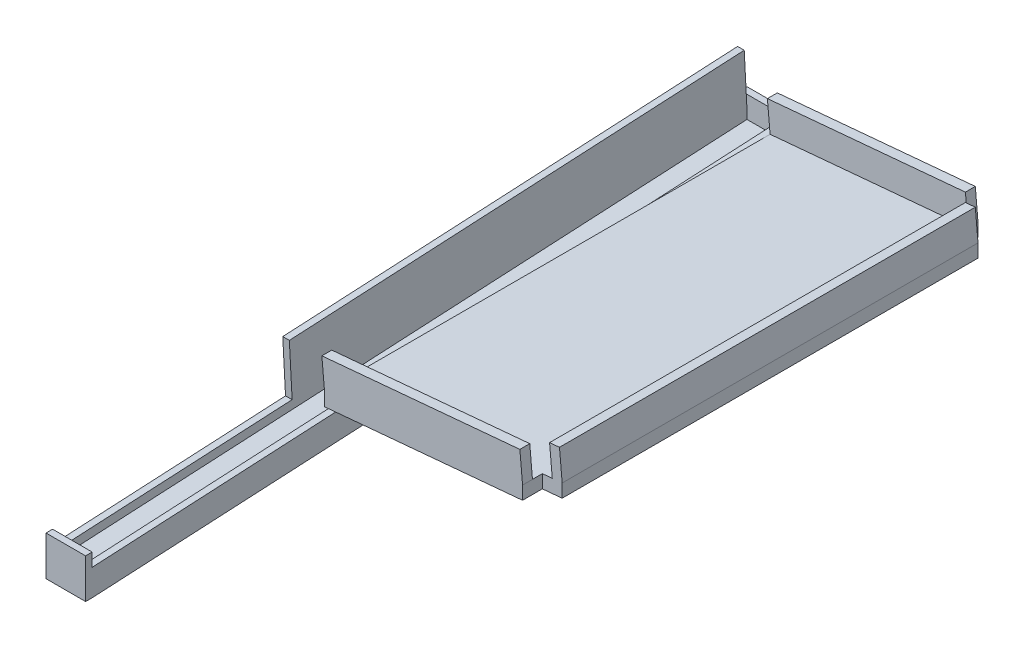
from build123d import *

# Parameters (mm, degrees)
BOSS_EXTRUDE1_DEPTH  = 690
SKETCH3_W            = 30
SKETCH3_H            = 30
CUT_EXTRUDE2_DEPTH   = 767.485485838
BOSS_EXTRUDE2_DEPTH  = 60
SKETCH6_W            = 40
SKETCH6_H            = 1043.42998453
CUT_EXTRUDE3_DEPTH   = 13
SKETCH7_W            = 40
SKETCH7_H            = 13
CUT_EXTRUDE4_DEPTH   = 1098.004231757
SKETCH10_W           = 60
SKETCH10_H           = 60
BOSS_EXTRUDE4_DEPTH  = 10
BOSS_EXTRUDE8_DEPTH  = 30
SKETCH17_W           = 301.23711865
SKETCH17_H           = 15
SKETCH17_W_2         = 15.061855932
SKETCH17_H_2         = 630
BOSS_EXTRUDE9_DEPTH  = 45
SKETCH8_W            = 10
SKETCH8_H            = 690.069913578
BOSS_EXTRUDE10_DEPTH = 80
SKETCH21_W           = 60
SKETCH21_H           = 60
BOSS_EXTRUDE14_DEPTH = 10


with BuildPart() as part:
    # Sketch1 → Boss-Extrude1 (new body)
    with BuildSketch(Plane.XY):
        Polygon((0, 20), (0, 0), (330, 30), (330, 50), align=None)
    extrude(amount=BOSS_EXTRUDE1_DEPTH)

    # Sketch3 → Cut-Extrude2 (cut, through all)
    with BuildSketch(Plane(origin=(0, 0, 0), x_dir=(1, 0, 0), z_dir=(0, 1, 0))):
        with Locations((315, -675)):
            Rectangle(SKETCH3_W, SKETCH3_H)
        with Locations((315, -15)):
            Rectangle(SKETCH3_W, SKETCH3_H)
    extrude(amount=CUT_EXTRUDE2_DEPTH, mode=Mode.SUBTRACT)

    # Sketch4 → Boss-Extrude2 (add)
    with BuildSketch(Plane.ZY):
        Polygon((0, 20), (0, 0), (0, -20), (1042, -74.608906013), (1042, -54.608906013), (1042, -34.608906013), align=None)
    extrude(amount=BOSS_EXTRUDE2_DEPTH)

    # Sketch6 → Cut-Extrude3 (cut)
    with BuildSketch(Plane(origin=(0, 19.945218954, 1.045284633), x_dir=(1, 0, 0), z_dir=(0, 0.9986295347545742, 0.05233595624294041))):
        with Locations((-30, -520.66827314)):
            Rectangle(SKETCH6_W, SKETCH6_H)
    extrude(amount=-CUT_EXTRUDE3_DEPTH, mode=Mode.SUBTRACT)

    # Sketch7 → Cut-Extrude4 (cut, through all)
    with BuildSketch(Plane(origin=(0, -54.554124967, 1040.954715367), x_dir=(-1, 0, 0), z_dir=(0, 0.05233595624294042, -0.9986295347545742))):
        with Locations((30, 13.472590695)):
            Rectangle(SKETCH7_W, SKETCH7_H)
    extrude(amount=-CUT_EXTRUDE4_DEPTH, mode=Mode.SUBTRACT)

    # Sketch10 → Boss-Extrude4 (add)
    with BuildSketch(Plane.XY.offset(1042)):
        with Locations((-30, -44.608906013)):
            Rectangle(SKETCH10_W, SKETCH10_H)
    extrude(amount=BOSS_EXTRUDE4_DEPTH)

    # Sketch16 → Boss-Extrude8 (add)
    with BuildSketch(Plane.ZY.offset(60)):
        Polygon((0, -20), (0, -80), (30, -80), (30, -21.572233378), align=None)
        Polygon((521, -47.304453006), (521, -80), (551, -80), (551, -48.876686385), align=None)
    extrude(amount=-BOSS_EXTRUDE8_DEPTH)

    # Sketch17 → Boss-Extrude9 (add)
    with BuildSketch(Plane(origin=(-1.803278689, 19.836065574, 0), x_dir=(0.9958932064677039, 0.09053574604251852, 0), z_dir=(-0.09053574604251852, 0.9958932064677039, 0))):
        with Locations((152.429274246, -7.5)):
            Rectangle(SKETCH17_W, SKETCH17_H)
        with Locations((325.64061747, -345)):
            Rectangle(SKETCH17_W_2, SKETCH17_H_2)
        with Locations((152.429274246, -682.5)):
            Rectangle(SKETCH17_W, SKETCH17_H)
    extrude(amount=BOSS_EXTRUDE9_DEPTH)

    # Sketch8 → Boss-Extrude10 (add)
    with BuildSketch(Plane(origin=(0, 19.945218954, 1.045284633), x_dir=(1, 0, 0), z_dir=(0, 0.9986295347545742, 0.05233595624294041))):
        with Locations((-55, -343.988237664)):
            Rectangle(SKETCH8_W, SKETCH8_H)
    extrude(amount=BOSS_EXTRUDE10_DEPTH)


with BuildPart() as body_2:
    # Sketch21 → Boss-Extrude14 (new body)
    with BuildSketch(Plane(origin=(0, 0, 0), x_dir=(-1, 0, 0), z_dir=(0, 0, -1))):
        with Locations((30, 10)):
            Rectangle(SKETCH21_W, SKETCH21_H)
    extrude(amount=BOSS_EXTRUDE14_DEPTH)


solid = Compound([part.part, body_2.part])
